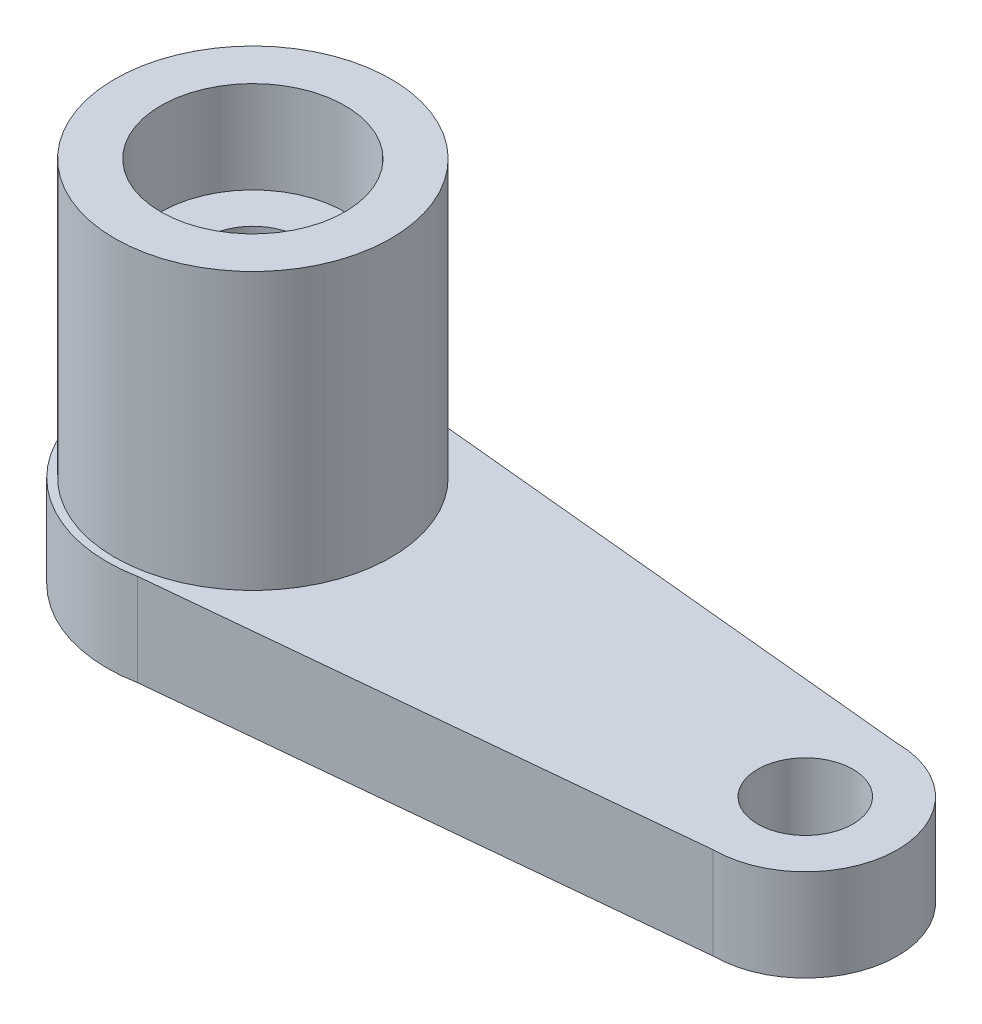
from build123d import *

# Parameters (mm, degrees)
BOSS_EXTRUDE1_DEPTH = 3
CUT_EXTRUDE1_REACH  = 23.739
SKETCH2_R           = 1.55
SKETCH3_R           = 4.5
BOSS_EXTRUDE2_DEPTH = 9
SKETCH4_R           = 3
CUT_EXTRUDE2_DEPTH  = 2.5
CUT_EXTRUDE3_START  = -3
SKETCH5_R           = 3
CUT_EXTRUDE3_DEPTH  = 3
CUT_EXTRUDE4_REACH  = 25.336
SKETCH6_R           = 1.55


with BuildPart() as part:
    # Sketch1 → Boss-Extrude1 (new body)
    with BuildSketch(Plane(origin=(0, 0, 0), x_dir=(1, 0, 0), z_dir=(0, 1, 0))):
        with BuildLine():
            Line((0.9, 4.663957547), (18, 3))
            ThreePointArc((18, 3), (21, 0), (18, -3))
            Line((18, -3), (0.9, -4.663957547))
            ThreePointArc((0.9, -4.663957547), (-4.75, 0), (0.9, 4.663957547))
        make_face()
    extrude(amount=BOSS_EXTRUDE1_DEPTH)

    # Sketch2 → Cut-Extrude1 (cut, up to next)
    with BuildSketch(Plane(origin=(0, 3, 0), x_dir=(1, 0, 0), z_dir=(0, 1, 0)), mode=Mode.PRIVATE) as cut_extrude1_sk1:
        with Locations((18, 0)):
            Circle(SKETCH2_R)
    cut_extrude1_tool1 = extrude(cut_extrude1_sk1.sketch, amount=-CUT_EXTRUDE1_REACH, mode=Mode.PRIVATE) & part.part
    add(cut_extrude1_tool1.solids().sort_by_distance((18, 3, 0))[0], mode=Mode.SUBTRACT)

    # Sketch3 → Boss-Extrude2 (add)
    with BuildSketch(Plane(origin=(0, 3, 0), x_dir=(1, 0, 0), z_dir=(0, 1, 0))):
        Circle(SKETCH3_R)
    extrude(amount=BOSS_EXTRUDE2_DEPTH)

    # Sketch4 → Cut-Extrude2 (cut)
    with BuildSketch(Plane.XZ):
        Circle(SKETCH4_R)
    extrude(amount=-CUT_EXTRUDE2_DEPTH, mode=Mode.SUBTRACT)

    # Sketch5 → Cut-Extrude3 (cut)
    with BuildSketch(Plane(origin=(0, 12, 0), x_dir=(1, 0, 0), z_dir=(0, 1, 0)).offset(CUT_EXTRUDE3_START)):
        Circle(SKETCH5_R)
    extrude(amount=CUT_EXTRUDE3_DEPTH, mode=Mode.SUBTRACT)

    # Sketch6 → Cut-Extrude4 (cut, up to next)
    with BuildSketch(Plane(origin=(0, 9, 0), x_dir=(1, 0, 0), z_dir=(0, 1, 0)), mode=Mode.PRIVATE) as cut_extrude4_sk1:
        Circle(SKETCH6_R)
    cut_extrude4_tool1 = extrude(cut_extrude4_sk1.sketch, amount=-CUT_EXTRUDE4_REACH, mode=Mode.PRIVATE) & part.part
    add(cut_extrude4_tool1.solids().sort_by_distance((0, 9, 0))[0], mode=Mode.SUBTRACT)


solid = part.part
